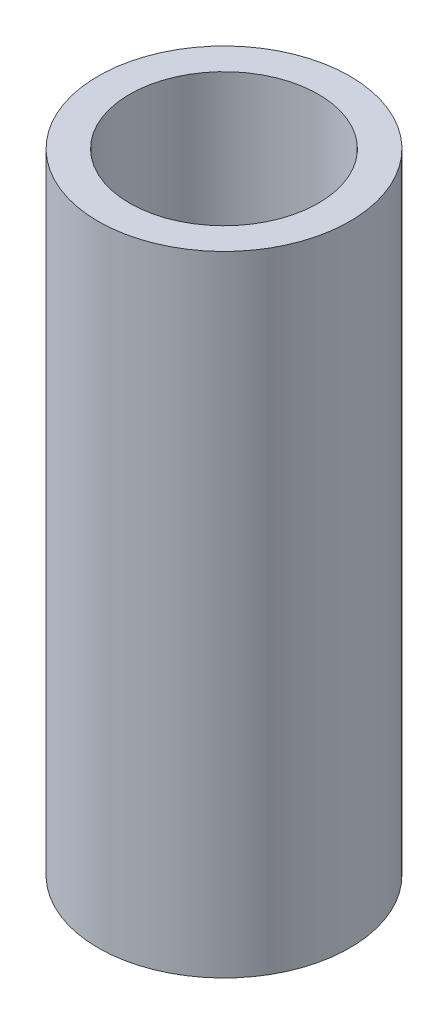
from build123d import *

# Parameters (mm, degrees)
SKETCH1_R           = 3
BOSS_EXTRUDE1_DEPTH = 15
SKETCH2_R           = 2.25
CUT_EXTRUDE1_DEPTH  = 16.588457268


with BuildPart() as part:
    # Sketch1 → Boss-Extrude1 (new body)
    with BuildSketch(Plane(origin=(0, 0, 0), x_dir=(1, 0, 0), z_dir=(0, 1, 0))):
        Circle(SKETCH1_R)
    extrude(amount=BOSS_EXTRUDE1_DEPTH)

    # Sketch2 → Cut-Extrude1 (cut, through all)
    with BuildSketch(Plane(origin=(0, 15, 0), x_dir=(1, 0, 0), z_dir=(0, 1, 0))):
        Circle(SKETCH2_R)
    extrude(amount=-CUT_EXTRUDE1_DEPTH, mode=Mode.SUBTRACT)


solid = part.part
